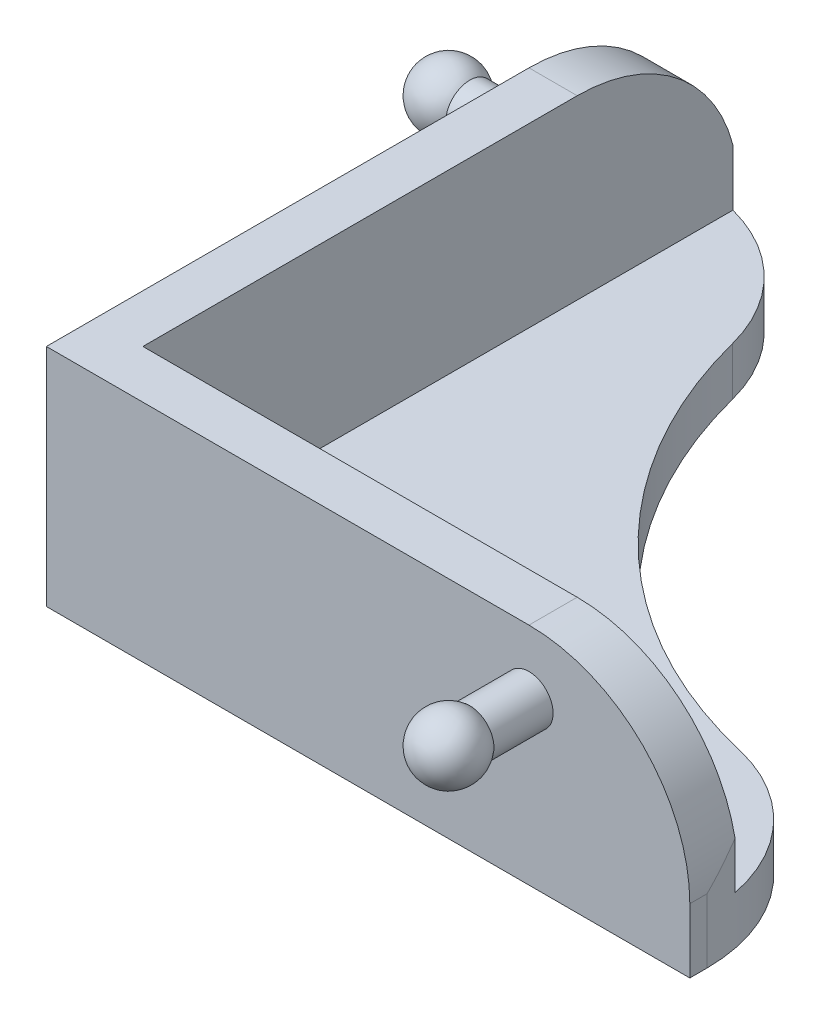
from build123d import *

# Parameters (mm, degrees)
BOSS_EXTRUDE2_DEPTH = 3
BOSS_EXTRUDE3_DEPTH = 14
FILLET2_R           = 10
SKETCH3_R           = 1.5
BOSS_EXTRUDE4_DEPTH = 5
SKETCH2_R           = 1.5
BOSS_EXTRUDE5_DEPTH = 5


with BuildPart() as part:
    # Sketch1 → Boss-Extrude2 (new body)
    with BuildSketch(Plane(origin=(0, 0, 0), x_dir=(1, 0, 0), z_dir=(0, 1, 0))):
        with BuildLine():
            Line((-13.813102114, 29.179914519), (-13.813102114, -7.497737557))
            Line((-13.813102114, -7.497737557), (22.999876511, -7.497737557))
            ThreePointArc((22.999876511, -7.497737557), (20.393331118, -2.4896323), (15.489720926, 0.308546434))
            ThreePointArc((15.489720926, 0.308546434), (1.40152336, 8.074710364), (-6.649185051, 22.002262443))
            ThreePointArc((-6.649185051, 22.002262443), (-9.253806843, 26.566555008), (-13.813102114, 29.179914519))
        make_face()
        with BuildLine():
            Line((22.999876511, -7.497737557), (-13.813102114, -7.497737557))
            Line((-13.813102114, -7.497737557), (-13.813102114, 29.179914519))
            ThreePointArc((-13.813102114, 29.179914519), (-15.062100342, 29.421348106), (-16.331643417, 29.502262443))
            Line((-16.331643417, 29.502262443), (-16.813102114, 29.502262443))
            Line((-16.813102114, 29.502262443), (-16.813102114, -10.497737557))
            Line((-16.813102114, -10.497737557), (23.186897886, -10.497737557))
            Line((23.186897886, -10.497737557), (23.186897886, -9.422692236))
            ThreePointArc((23.186897886, -9.422692236), (23.140032725, -8.455682992), (22.999876511, -7.497737557))
        make_face()
    extrude(amount=BOSS_EXTRUDE2_DEPTH)

    # Sketch1<4> → Boss-Extrude3 (add)
    with BuildSketch(Plane(origin=(0, 0, 0), x_dir=(1, 0, 0), z_dir=(0, 1, 0))):
        with BuildLine():
            Line((22.999876511, -7.497737557), (-13.813102114, -7.497737557))
            Line((-13.813102114, -7.497737557), (-13.813102114, 29.179914519))
            ThreePointArc((-13.813102114, 29.179914519), (-15.062100342, 29.421348106), (-16.331643417, 29.502262443))
            Line((-16.331643417, 29.502262443), (-16.813102114, 29.502262443))
            Line((-16.813102114, 29.502262443), (-16.813102114, -10.497737557))
            Line((-16.813102114, -10.497737557), (23.186897886, -10.497737557))
            Line((23.186897886, -10.497737557), (23.186897886, -9.422692236))
            ThreePointArc((23.186897886, -9.422692236), (23.140032725, -8.455682992), (22.999876511, -7.497737557))
        make_face()
    extrude(amount=BOSS_EXTRUDE3_DEPTH)

    # Fillet2
    # the kernel refuses this fillet: 10 mm, written as the material it takes off along each edge
    with BuildSketch(Plane(origin=(8.668356583, 14, -29.502262443), x_dir=(0, -1, 0), z_dir=(-1, 0, 0))) as fillet2_piece_1:
        with BuildLine():
            CenterArc((FILLET2_R, FILLET2_R), FILLET2_R, 180, 90)
            Line((0, FILLET2_R), (0, 0))
            Line((0, 0), (FILLET2_R, 0))
        make_face()
    extrude(amount=50.481458697, mode=Mode.SUBTRACT)
    with BuildSketch(Plane(origin=(23.186897886, 14, 35.497737557), x_dir=(-1, 0, 0), z_dir=(0, 0, -1))) as fillet2_piece_2:
        with BuildLine():
            CenterArc((FILLET2_R, -FILLET2_R), FILLET2_R, 90, 90)
            Line((0, -FILLET2_R), (0, 0))
            Line((0, 0), (FILLET2_R, 0))
        make_face()
    extrude(amount=51.075045321, mode=Mode.SUBTRACT)

    # Sketch3 → Boss-Extrude4 (add)
    with BuildSketch(Plane.ZY.offset(16.813102114)):
        with Locations((-19.502262443, 10)):
            Circle(SKETCH3_R)
    extrude(amount=BOSS_EXTRUDE4_DEPTH)

    # Sketch4 → Revolve1 (revolve)
    with BuildSketch(Plane.ZY.offset(21.813102114)):
        with BuildLine():
            Line((-19.502262443, 12), (-19.502262443, 8))
            ThreePointArc((-19.502262443, 8), (-21.502262443, 10), (-19.502262443, 12))
        make_face()
    revolve(axis=Axis((-21.813102114, 12, -19.502262443), (0, -1, 0)))

    # Sketch2 → Boss-Extrude5 (add)
    with BuildSketch(Plane.XY.offset(10.497737557)):
        with Locations((13.186897886, 10)):
            Circle(SKETCH2_R)
    extrude(amount=BOSS_EXTRUDE5_DEPTH)

    # Sketch5 → Revolve2 (revolve)
    with BuildSketch(Plane.XY.offset(15.497737557)):
        with BuildLine():
            Line((13.186897886, 12), (13.186897886, 8))
            ThreePointArc((13.186897886, 8), (11.186897886, 10), (13.186897886, 12))
        make_face()
    revolve(axis=Axis((13.186897886, 12, 15.497737557), (0, -1, 0)))


solid = part.part
